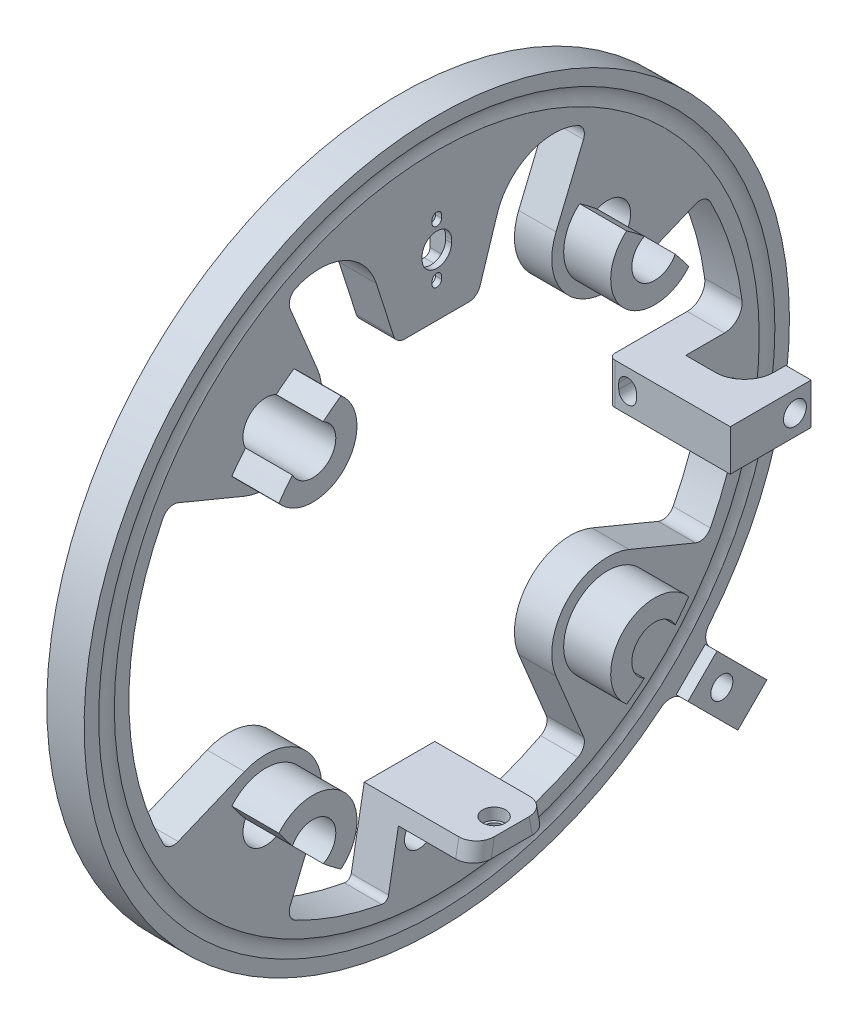
from build123d import *

# Parameters (mm, degrees)
SKETCH1_R                = 60
SKETCH1_R_2              = 52.38
BOSS_EXTRUDE1_DEPTH      = 6.35
BOSS_EXTRUDE2_DEPTH      = 6.35
SKETCH3_R                = 7.5
BOSS_EXTRUDE3_DEPTH      = 8
SKETCH4_R                = 3.9
CUT_EXTRUDE2_DEPTH       = 87.057669618
FILLET5_R                = 2
CIRPATTERN1_COUNT        = 4
FILLET5_OF_CIRPATTERN1_R = 2
BOSS_EXTRUDE5_DEPTH      = 6.35
SKETCH6_W                = 10.4
SKETCH6_H                = 15
CUT_EXTRUDE1_DEPTH       = 5.35
FILLET1_R                = 1
FILLET2_R                = 10.08
FILLET3_R                = 2
SKETCH14_W               = 24.267829677
SKETCH14_H               = 7
BOSS_EXTRUDE8_DEPTH      = 6.35
FILLET7_R                = 3
SKETCH7_R                = 2.645
BOSS_EXTRUDE6_DEPTH      = 6.35
FILLET6_R                = 2.54
BOSS_EXTRUDE7_DEPTH      = 2
SKETCH15_W               = 13.75
SKETCH15_H               = 7
BOSS_EXTRUDE9_DEPTH      = 14.3
FILLET8_R                = 1
CUT_EXTRUDE7_DEPTH       = 88.329390814
SKETCH19_R               = 2.5
BOSS_EXTRUDE10_DEPTH     = 6.35
FILLET9_R                = 1
CUT_EXTRUDE8_DEPTH       = 4
CUT_EXTRUDE8_DEPTH_BACK  = 8
SKETCH20_R               = 60
SKETCH20_R_2             = 42.5
BOSS_EXTRUDE11_DEPTH     = 12.75
FILLET11_R               = 3
SKETCH24_R               = 1.95
CUT_EXTRUDE9_DEPTH       = 2
SKETCH25_R               = 1.5
CUT_EXTRUDE10_DEPTH      = 1
SKETCH26_R               = 1.875
CUT_EXTRUDE11_DEPTH      = 6.35
SKETCH29_W               = 2
SKETCH29_H               = 7.024362831
BOSS_EXTRUDE12_DEPTH     = 7
SKETCH27_R               = 1.95
CUT_EXTRUDE13_DEPTH      = 4.3
FILLET12_R               = 5
FILLET13_R               = 0.5


with BuildPart() as part:
    # Sketch1 → Boss-Extrude1 (new body)
    with BuildSketch(Plane(origin=(0, 0, 0), x_dir=(0, 0, -1), z_dir=(1, 0, 0))):
        Circle(SKETCH1_R)
        Circle(SKETCH1_R_2, mode=Mode.SUBTRACT)
    extrude(amount=BOSS_EXTRUDE1_DEPTH)

    # Sketch2 → Boss-Extrude2 (add)
    with BuildSketch(Plane.ZY):
        with BuildLine():
            Line((-20.283349363, 32.728361603), (-28.579201197, 52.756319612))
            Line((-28.579201197, 52.756319612), (-52.756319612, 28.579201197))
            Line((-52.756319612, 28.579201197), (-32.728361603, 20.283349363))
            ThreePointArc((-32.728361603, 20.283349363), (-22.348109819, 22.348109819), (-20.283349363, 32.728361603))
        make_face()
    boss_extrude2 = extrude(amount=-BOSS_EXTRUDE2_DEPTH)

    # Sketch3 → Boss-Extrude3 (add)
    with BuildSketch(Plane(origin=(6.35, 0, 0), x_dir=(0, 0, -1), z_dir=(1, 0, 0))):
        with Locations((29.08330191, 29.08330191)):
            Circle(SKETCH3_R)
    boss_extrude3 = extrude(amount=BOSS_EXTRUDE3_DEPTH)

    # Sketch4 → Cut-Extrude2 (cut, through all)
    with BuildSketch(Plane(origin=(14.35, 0, 0), x_dir=(0, 0, -1), z_dir=(1, 0, 0))):
        with Locations((29.08330191, 29.08330191)):
            Circle(SKETCH4_R)
    cut_extrude2 = extrude(amount=-CUT_EXTRUDE2_DEPTH, mode=Mode.SUBTRACT)

    # Fillet5
    fillet5_edges = [part.edges().sort_by_distance(p)[0] for p in [
        (3.175, 25.64506718, -45.672693476),
        (3.175, 45.672693476, -25.64506718),
    ]]
    fillet(fillet5_edges, radius=FILLET5_R)

    # CirPattern1: Boss-Extrude2, Boss-Extrude3, Cut-Extrude2 ×4 about axis
    cirpattern1_axis = Axis((0, 0, 0), (1, 0, 0))
    add([boss_extrude2.rotate(cirpattern1_axis, i * 360 / CIRPATTERN1_COUNT) for i in range(1, CIRPATTERN1_COUNT)])
    add([boss_extrude3.rotate(cirpattern1_axis, i * 360 / CIRPATTERN1_COUNT) for i in range(1, CIRPATTERN1_COUNT)])
    add([cut_extrude2.rotate(cirpattern1_axis, i * 360 / CIRPATTERN1_COUNT) for i in range(1, CIRPATTERN1_COUNT)], mode=Mode.SUBTRACT)

    # Fillet5 of CirPattern1
    fillet5_of_cirpattern1_edges = [part.edges().sort_by_distance(p)[0] for p in [
        (3.175, 45.672693476, 25.64506718),
        (3.175, 25.64506718, 45.672693476),
        (3.175, -25.64506718, 45.672693476),
        (3.175, -45.672693476, 25.64506718),
        (3.175, -45.672693476, -25.64506718),
        (3.175, -25.64506718, -45.672693476),
    ]]
    fillet(fillet5_of_cirpattern1_edges, radius=FILLET5_OF_CIRPATTERN1_R)

    # Sketch5 → Boss-Extrude5 (add)
    with BuildSketch(Plane.ZY):
        with BuildLine():
            Line((6.902803858, 29.806267599), (13.548649194, 50.597415992))
            ThreePointArc((13.548649194, 50.597415992), (0, 52.38), (-13.548649194, 50.597415992))
            Line((-13.548649194, 50.597415992), (-6.902803858, 29.806267599))
            Line((-6.902803858, 29.806267599), (6.902803858, 29.806267599))
        make_face()
        with BuildLine():
            ThreePointArc((0.8, 35.5), (0, 34.7), (-0.8, 35.5))
            Line((-0.8, 35.5), (-0.8, 36))
            ThreePointArc((-0.8, 36), (0, 36.8), (0.8, 36))
            Line((0.8, 36), (0.8, 35.5))
        make_face(mode=Mode.SUBTRACT)
        with BuildLine():
            ThreePointArc((2.5, 40), (0, 37.5), (-2.5, 40))
            Line((-2.5, 40), (-2.5, 40.5))
            ThreePointArc((-2.5, 40.5), (0, 43), (2.5, 40.5))
            Line((2.5, 40.5), (2.5, 40))
        make_face(mode=Mode.SUBTRACT)
        with BuildLine():
            ThreePointArc((0.8, 44.5), (0, 43.7), (-0.8, 44.5))
            Line((-0.8, 44.5), (-0.8, 45))
            ThreePointArc((-0.8, 45), (0, 45.8), (0.8, 45))
            Line((0.8, 45), (0.8, 44.5))
        make_face(mode=Mode.SUBTRACT)
    extrude(amount=-BOSS_EXTRUDE5_DEPTH)

    # Sketch6 → Cut-Extrude1 (cut)
    with BuildSketch(Plane.ZY):
        with Locations((0, 41.3)):
            Rectangle(SKETCH6_W, SKETCH6_H)
    extrude(amount=-CUT_EXTRUDE1_DEPTH, mode=Mode.SUBTRACT)

    # Fillet1
    fillet1_edges = [part.edges().sort_by_distance(p)[0] for p in [
        (2.675, 33.8, 5.2),
        (2.675, 48.8, 5.2),
        (2.675, 48.8, -5.2),
        (2.675, 33.8, -5.2),
    ]]
    fillet(fillet1_edges, radius=FILLET1_R)

    # Fillet2
    # the kernel refuses this fillet: 10.08 mm, written as the material it adds along each edge
    with BuildSketch(Plane(origin=(0, 50.597415992, -13.548649194), x_dir=(0, -0.36072585126841494, -0.9326718931257002), z_dir=(1, 0, 0))) as fillet2_piece_1:
        with BuildLine():
            CenterArc((10.699243054, -10.065979832), FILLET2_R, 86.977722607, 96.440691258)
            Line((0.637178233, -10.667021881), (0, 0))
            ThreePointArc((0, 0), (5.615351663, 0.301864226), (11.230703326, 0))
        make_face()
    extrude(amount=6.35)
    with BuildSketch(Plane(origin=(0, 50.597415992, 13.548649194), x_dir=(0, -0.9525214731914495, -0.3044714159148455), z_dir=(1, 0, 0))) as fillet2_piece_2:
        with BuildLine():
            CenterArc((10.686035369, -10.08), FILLET2_R, 90, 96.440691258)
            ThreePointArc((0.669655252, -11.210720719), (0.033500502, -5.623359674), (0, 0))
            Line((0, 0), (10.686035369, 0))
        make_face()
    extrude(amount=6.35)

    # Fillet3
    fillet3_edges = [part.edges().sort_by_distance(p)[0] for p in [
        (3.175, 29.806267599, -6.902803858),
        (3.175, 29.806267599, 6.902803858),
    ]]
    fillet(fillet3_edges, radius=FILLET3_R)

    # Sketch14 → Boss-Extrude8 (add)
    with BuildSketch(Plane.ZY):
        with Locations((-47.763914838, 0)):
            Rectangle(SKETCH14_W, SKETCH14_H)
    extrude(amount=-BOSS_EXTRUDE8_DEPTH)

    # Fillet7
    fillet7_edges = [part.edges().sort_by_distance(p)[0] for p in [
        (3.175, -3.5, -52.262935241),
        (3.175, 3.5, -52.262935241),
    ]]
    fillet(fillet7_edges, radius=FILLET7_R)

    # Sketch7 → Cut-Revolve1 (revolve, cut)
    with BuildSketch(Plane(origin=(0, 0, 0), x_dir=(1, 0, 0), z_dir=(0, 1, 0))):
        with Locations((8.636, 56.19)):
            Circle(SKETCH7_R)
        with Locations((-2.286, 56.19)):
            Circle(SKETCH7_R)
    revolve(axis=Axis((6.35, 0, 0), (-1, 0, 0)), mode=Mode.SUBTRACT)

    # Sketch9 → Boss-Extrude6 (add)
    with BuildSketch(Plane.ZY):
        Polygon((-54.162844789, -49.21309732), (-49.21309732, -54.162844789), (-39.879287809, -44.829035277), (-44.829035277, -39.879287809), align=None)
    extrude(amount=-BOSS_EXTRUDE6_DEPTH)

    # Fillet6
    fillet6_edges = [part.edges().sort_by_distance(p)[0] for p in [
        (3.175, -44.829035277, -39.879287809),
        (3.175, -39.879287809, -44.829035277),
    ]]
    fillet(fillet6_edges, radius=FILLET6_R)

    # Sketch10 → Boss-Extrude7 (add)
    with BuildSketch(Plane(origin=(6.35, 0, 0), x_dir=(0, 0, -1), z_dir=(1, 0, 0))):
        Polygon((49.21309732, -54.162844789), (54.162844789, -49.21309732), (45.677563414, -40.727815946), (40.727815946, -45.677563414), align=None)
    extrude(amount=BOSS_EXTRUDE7_DEPTH)

    # Sketch15 → Boss-Extrude9 (add)
    with BuildSketch(Plane(origin=(6.35, 0, 0), x_dir=(0, 0, -1), z_dir=(1, 0, 0))):
        with Locations((42.505, 0)):
            Rectangle(SKETCH15_W, SKETCH15_H)
    extrude(amount=BOSS_EXTRUDE9_DEPTH)

    # Fillet8
    fillet8_edges = [part.edges().sort_by_distance(p)[0] for p in [
        (0, 0, -35.63),
        (0, -51.687971055, -51.687971055),
    ]]
    fillet(fillet8_edges, radius=FILLET8_R)

    # Sketch18 → Cut-Extrude7 (cut, through all)
    with BuildSketch(Plane.XY):
        with BuildLine():
            Line((1.675, -0.5), (1.675, 0.5))
            ThreePointArc((1.675, 0.5), (3.175, 2), (4.675, 0.5))
            Line((4.675, 0.5), (4.675, -0.5))
            ThreePointArc((4.675, -0.5), (3.175, -2), (1.675, -0.5))
        make_face()
    extrude(amount=-CUT_EXTRUDE7_DEPTH, mode=Mode.SUBTRACT)

    # Sketch19 → Boss-Extrude10 (add)
    with BuildSketch(Plane.ZY):
        Polygon((6, -38.38), (-6, -38.38), (-8.5, -52.38), (8.5, -52.38), align=None)
        with Locations((3, -44)):
            Circle(SKETCH19_R, mode=Mode.SUBTRACT)
        with Locations((-3, -44)):
            Circle(SKETCH19_R, mode=Mode.SUBTRACT)
    extrude(amount=-BOSS_EXTRUDE10_DEPTH)

    # Fillet9
    fillet9_edges = [part.edges().sort_by_distance(p)[0] for p in [
        (3.175, -51.705394286, -8.379534694),
        (3.175, -51.705394286, 8.379534694),
    ]]
    fillet(fillet9_edges, radius=FILLET9_R)

    # Sketch20 → Cut-Extrude8 (cut, two sides: drawn at the far end of the back side and taken through both)
    with BuildSketch(Plane(origin=(14.35, 0, 0), x_dir=(0, 0, -1), z_dir=(1, 0, 0)).offset(-CUT_EXTRUDE8_DEPTH_BACK)):
        Circle(SKETCH20_R)
        Circle(SKETCH20_R_2, mode=Mode.SUBTRACT)
    extrude(amount=CUT_EXTRUDE8_DEPTH + CUT_EXTRUDE8_DEPTH_BACK, mode=Mode.SUBTRACT)

    # Sketch23 → Boss-Extrude11 (add)
    with BuildSketch(Plane(origin=(6.35, 0, 0), x_dir=(0, 0, -1), z_dir=(1, 0, 0))):
        Polygon((6, -38.38), (-6, -38.38), (-6.535714286, -41.38), (6.535714286, -41.38), align=None)
    extrude(amount=BOSS_EXTRUDE11_DEPTH)

    # Fillet11
    fillet11_edges = [part.edges().sort_by_distance(p)[0] for p in [
        (19.1, -39.88, -6.267857143),
        (19.1, -39.88, 6.267857143),
    ]]
    fillet(fillet11_edges, radius=FILLET11_R)

    # Sketch24 → Cut-Extrude9 (cut)
    with BuildSketch(Plane(origin=(0, -38.38, 0), x_dir=(1, 0, 0), z_dir=(0, 1, 0))):
        with Locations(Location((16.1, 0, 0), (0, 0, 270))):
            Circle(SKETCH24_R)
    extrude(amount=-CUT_EXTRUDE9_DEPTH, mode=Mode.SUBTRACT)

    # Sketch25 → Cut-Extrude10 (cut)
    with BuildSketch(Plane(origin=(0, -40.38, 0), x_dir=(1, 0, 0), z_dir=(0, 1, 0))):
        with Locations(Location((16.1, 0, 0), (0, 0, 270))):
            Circle(SKETCH25_R)
    extrude(amount=-CUT_EXTRUDE10_DEPTH, mode=Mode.SUBTRACT)

    # Sketch26 → Cut-Extrude11 (cut)
    with BuildSketch(Plane(origin=(8.35, 0, 0), x_dir=(0, 0, -1), z_dir=(1, 0, 0))):
        with Locations((46.499341931, -46.499341931)):
            Circle(SKETCH26_R)
    extrude(amount=-CUT_EXTRUDE11_DEPTH, mode=Mode.SUBTRACT)

    # Sketch29 → Boss-Extrude12 (add)
    with BuildSketch(Plane.XZ.offset(3.5)):
        with Locations((17.35, -45.867818585)):
            Rectangle(SKETCH29_W, SKETCH29_H)
    extrude(amount=-BOSS_EXTRUDE12_DEPTH)

    # Sketch27 → Cut-Extrude13 (cut)
    with BuildSketch(Plane(origin=(20.65, 0, 0), x_dir=(0, 0, -1), z_dir=(1, 0, 0))):
        with Locations((46.63, 0)):
            Circle(SKETCH27_R)
    extrude(amount=-CUT_EXTRUDE13_DEPTH, mode=Mode.SUBTRACT)

    # Fillet12
    # the kernel refuses this fillet: 5 mm, written as the material it adds along each edge
    with BuildSketch(Plane(origin=(16.35, 0, 0), x_dir=(0, -0.3677285674960848, -0.9299331699897995), z_dir=(0, -0.9299331699897995, 0.3677285674960848))) as fillet12_piece_1_section:
        with BuildLine():
            CenterArc((42.5 + FILLET12_R, -FILLET12_R), FILLET12_R, 90, 90)
            Line((42.5 + FILLET12_R, 0), (42.5, 0))
            Line((42.5, 0), (42.5, -FILLET12_R))
        make_face()
    fillet12_piece_1 = revolve(axis=Axis((16.35, 0, 0), (1, 0, 0)), revolution_arc=43.151200383, mode=Mode.PRIVATE)
    fillet12_piece_1 = split(fillet12_piece_1, bisect_by=Plane(origin=(16.35, -3.5, 0), z_dir=(0, 1, 0)), keep=Keep.TOP, mode=Mode.PRIVATE)
    fillet12_piece_1 = split(fillet12_piece_1, bisect_by=Plane(origin=(16.35, 3.5, 0), z_dir=(0, -1, 0)), keep=Keep.TOP, mode=Mode.PRIVATE)
    fillet12_piece_1 = fillet12_piece_1 - Plane(origin=(16.35, 0, -46.63), x_dir=(0, 0, -1), z_dir=(1, 0, 0)) * Cylinder(1.95, 190, mode=Mode.PRIVATE)
    add(fillet12_piece_1)

    # Fillet13
    fillet13_edges = [part.edges().sort_by_distance(p)[0] for p in [
        (5.35, 41.3, 5.2),
        (5.35, 33.8, 0),
        (5.35, 41.3, -5.2),
        (5.35, 48.8, 0),
        (5.35, 34.092893219, -4.907106781),
        (5.35, 48.507106781, 4.907106781),
        (5.35, 48.507106781, -4.907106781),
        (5.35, 34.092893219, 4.907106781),
    ]]
    fillet(fillet13_edges, radius=FILLET13_R)


solid = part.part
